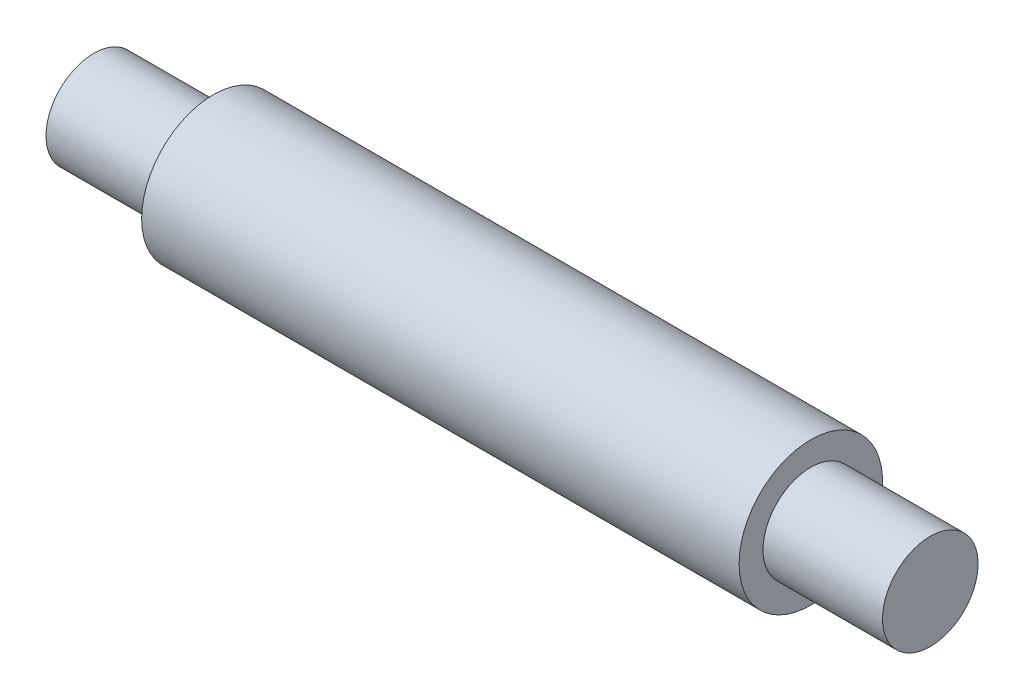
from build123d import *


with BuildPart() as part:
    # Sketch1 → Revolve1 (revolve)
    with BuildSketch(Plane.XY):
        Polygon((0, 0), (70, 0), (70, 4), (60, 4), (60, 6), (10, 6), (10, 4), (0, 4), align=None)
    revolve(axis=Axis((0, 0, 0), (1, 0, 0)))


solid = part.part
